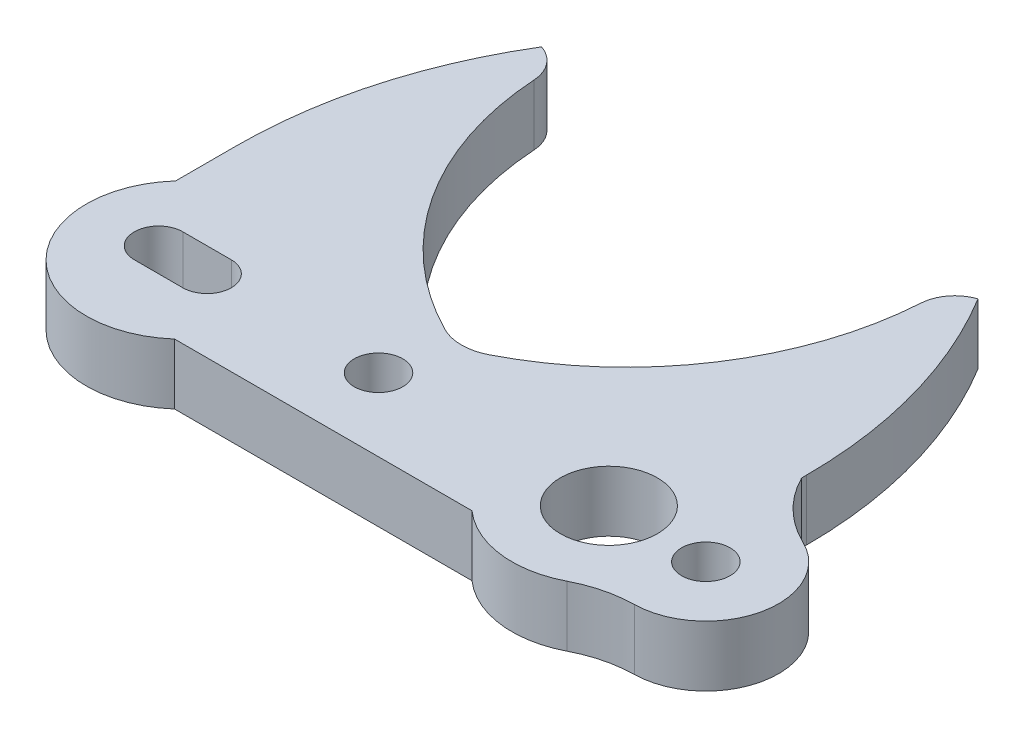
from build123d import *

# Parameters (mm, degrees)
SKETCH1_R           = 4
SKETCH1_R_2         = 2
BOSS_EXTRUDE1_DEPTH = 5
FILLET1_R           = 4
FILLET2_R           = 3
FILLET3_R           = 3


with BuildPart() as part:
    # Sketch1 → Boss-Extrude1 (new body)
    with BuildSketch(Plane(origin=(0, 0, 0), x_dir=(1, 0, 0), z_dir=(0, 1, 0))):
        with BuildLine():
            Line((-16, 33.943656531), (-16, 32.943656531))
            ThreePointArc((-16, 32.943656531), (-11.633307653, 18.521451429), (0, 8.943656531))
            ThreePointArc((0, 8.943656531), (11.633307653, 18.521451429), (16, 32.943656531))
            Line((16, 32.943656531), (16, 33.943656531))
            Line((16, 33.943656531), (18, 33.943656531))
            ThreePointArc((18, 33.943656531), (22.110006153, 24.491379681), (23.514801823, 14.280393571))
            Line((23.514801823, 14.280393571), (23.514801823, 13.884283426))
            ThreePointArc((23.514801823, 13.884283426), (25.450700755, 11.237241369), (28.138825911, 9.35880599))
            ThreePointArc((28.138825911, 9.35880599), (31.417131183, 2.664821909), (25.64875, -2.055611002))
            ThreePointArc((25.64875, -2.055611002), (23.370974699, -2.355136602), (21.221666667, -3.166586471))
            ThreePointArc((21.221666667, -3.166586471), (16.57103717, -3.995601441), (12.263497378, -2.056343469))
            Line((12.263497378, -2.056343469), (-12.263497378, -2.056343469))
            ThreePointArc((-12.263497378, -2.056343469), (-23.233209016, -1.691762031), (-23.514801823, 9.280393571))
            Line((-23.514801823, 9.280393571), (-23.514801823, 14.280393571))
            ThreePointArc((-23.514801823, 14.280393571), (-22.110006153, 24.491379681), (-18, 33.943656531))
            Line((-18, 33.943656531), (-16, 33.943656531))
        make_face()
        with Locations(Location((17.555, 3.943656531, 0), (0, 0, 270))):
            Circle(SKETCH1_R, mode=Mode.SUBTRACT)
        with Locations(Location((25.555, 3.943656531, 0), (0, 0, 270))):
            Circle(SKETCH1_R_2, mode=Mode.SUBTRACT)
        with Locations(Location((-1.445, 3.943656531, 0), (0, 0, 270))):
            Circle(SKETCH1_R_2, mode=Mode.SUBTRACT)
        with BuildLine():
            Line((-19.585, 5.943656531), (-15.585, 5.943656531))
            ThreePointArc((-15.585, 5.943656531), (-13.585, 3.943656531), (-15.585, 1.943656531))
            Line((-15.585, 1.943656531), (-19.585, 1.943656531))
            ThreePointArc((-19.585, 1.943656531), (-21.585, 3.943656531), (-19.585, 5.943656531))
        make_face(mode=Mode.SUBTRACT)
    extrude(amount=BOSS_EXTRUDE1_DEPTH)

    # Fillet1
    fillet1_edges = [part.edges().sort_by_distance(p)[0] for p in [
        (0, 2.5, -8.943656531),
    ]]
    fillet(fillet1_edges, radius=FILLET1_R)

    # Fillet2
    # the kernel refuses this fillet: 3 mm, written as the material it takes off along each edge
    with BuildSketch(Plane(origin=(-16, -6.644712065, -33.943656531), x_dir=(0.019894609369720675, 0, 0.999802082673379), z_dir=(0, 1, 0))) as fillet2_piece_1:
        with BuildLine():
            CenterArc((2.789518237, -2.997110716), FILLET2_R, 92.514820362, 68.064461233)
            Line((-0.039789219, -1.999604165), (-0.322719964, -1.89985351))
            ThreePointArc((-0.322719964, -1.89985351), (-0.319835234, -0.9938337), (-0.299940625, 0.005968383))
            Line((-0.299940625, 0.005968383), (0.005968383, 0.299940625))
            ThreePointArc((0.005968383, 0.299940625), (1.005770465, 0.280046015), (2.644721485, 0.299711072))
            Line((2.644721485, 0.299711072), (2.657884826, 0))
        make_face()
    extrude(amount=18.289424129, mode=Mode.SUBTRACT)

    # Fillet3
    # the kernel refuses this fillet: 3 mm, written as the material it takes off along each edge
    with BuildSketch(Plane(origin=(16, -6.644712065, -33.943656531), x_dir=(1, 0, 0), z_dir=(0, 1, 0))) as fillet3_piece_1:
        with BuildLine():
            CenterArc((2.94102116, -2.84859249), FILLET3_R, 108.280766047, 68.064461233)
            Line((-0.05287758, -2.657358784), (-0.352267454, -2.638235414))
            ThreePointArc((-0.352267454, -2.638235414), (-0.3, -1), (-0.3, 0))
            Line((-0.3, 0), (0, 0.3))
            ThreePointArc((0, 0.3), (1, 0.3), (1.905897884, 0.284859249))
            Line((1.905897884, 0.284859249), (2, 0))
        make_face()
    extrude(amount=18.289424129, mode=Mode.SUBTRACT)


solid = part.part
